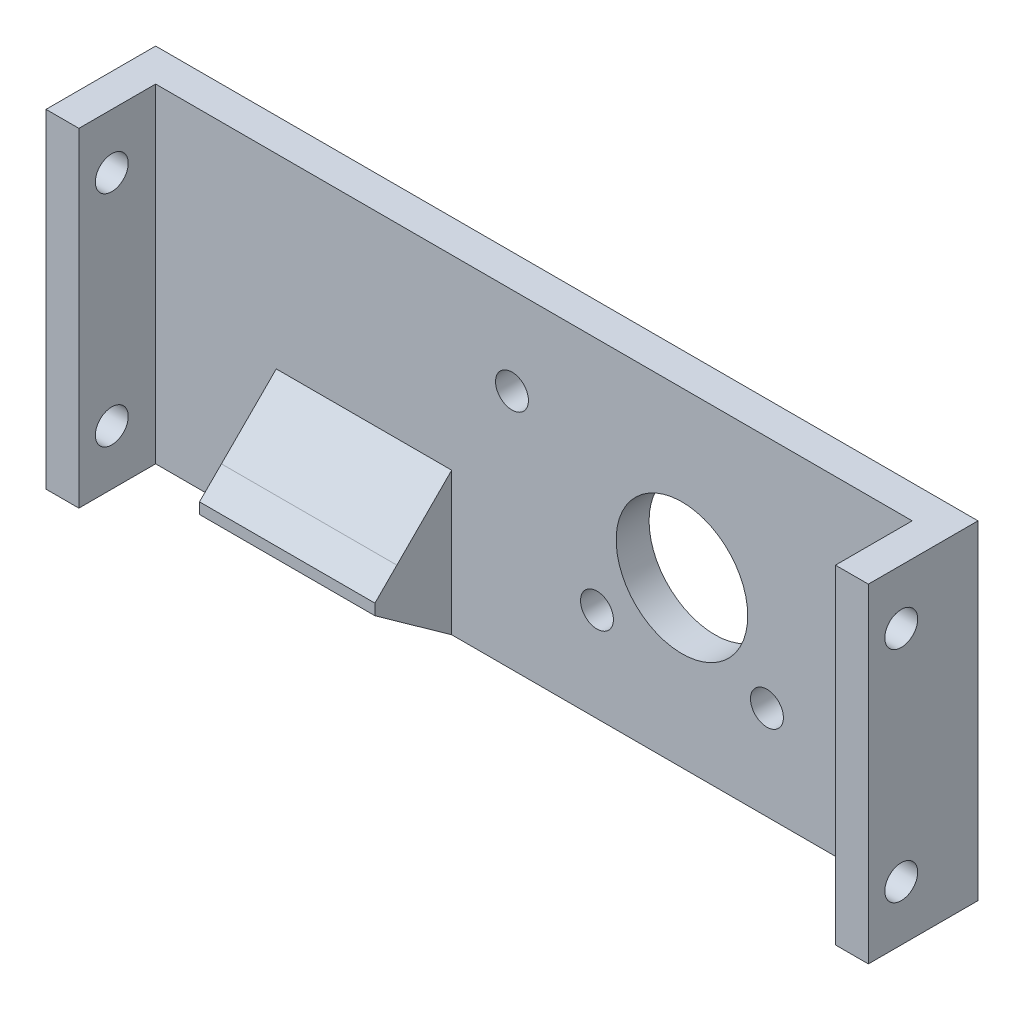
from build123d import *

# Parameters (mm, degrees)
SKETCH1_W               = 75
SKETCH1_H               = 30
BOSS_EXTRUDE1_DEPTH     = 3
SKETCH2_W               = 3
SKETCH2_H               = 30
BOSS_EXTRUDE2_DEPTH     = 10
SKETCH4_R               = 1.5
CUT_EXTRUDE1_DEPTH      = 3
MIRROR1_COPY_1_SKETCH_R = 1.5
MIRROR1_COPY_1_DEPTH    = 3
SKETCH5_R               = 6
SKETCH5_R_2             = 1.5
CUT_EXTRUDE2_DEPTH      = 10
SKETCH6_W               = 16
SKETCH6_H               = 7
BOSS_EXTRUDE3_DEPTH     = 8
CHAMFER1_SIZE           = 7
CHAMFER1_SIZE2          = 5
SKETCH7_R               = 1.5
CUT_EXTRUDE3_DEPTH      = 5
CHAMFER2_SIZE           = 5
CHAMFER3_SIZE           = 2
CUT_EXTRUDE4_START      = -5
CUT_EXTRUDE4_DEPTH      = 42.544442581


with BuildPart() as part:
    # Sketch1 → Boss-Extrude1 (new body)
    with BuildSketch(Plane.XY):
        Rectangle(SKETCH1_W, SKETCH1_H)
    extrude(amount=BOSS_EXTRUDE1_DEPTH)

    # Sketch2 → Boss-Extrude2 (add)
    with BuildSketch(Plane(origin=(0, 0, 0), x_dir=(-1, 0, 0), z_dir=(0, 0, -1))):
        with Locations((-36, 0)):
            Rectangle(SKETCH2_W, SKETCH2_H)
    boss_extrude2 = extrude(amount=-BOSS_EXTRUDE2_DEPTH)

    # Sketch4 → Cut-Extrude1 (cut)
    with BuildSketch(Plane.ZY.offset(-34.5)):
        with Locations((7, 10)):
            Circle(SKETCH4_R)
    cut_extrude1 = extrude(amount=-CUT_EXTRUDE1_DEPTH, mode=Mode.SUBTRACT)

    # Mirror2: Cut-Extrude1 across plane
    add(cut_extrude1.mirror(Plane.ZX), mode=Mode.SUBTRACT)

    # Mirror1: Boss-Extrude2, Cut-Extrude1 across plane
    add(boss_extrude2.mirror(Plane(origin=(0, 0, 0), x_dir=(0, 0, 1), z_dir=(1, 0, 0))))
    add(cut_extrude1.mirror(Plane(origin=(0, 0, 0), x_dir=(0, 0, 1), z_dir=(1, 0, 0))), mode=Mode.SUBTRACT)

    # Mirror1 copy 1 sketch → Mirror1 copy 1 (cut)
    with BuildSketch(Plane(origin=(-34.5, 0, 0), x_dir=(0, 0, 1), z_dir=(1, 0, 0))):
        with Locations((7, 10)):
            Circle(MIRROR1_COPY_1_SKETCH_R)
    extrude(amount=-MIRROR1_COPY_1_DEPTH, mode=Mode.SUBTRACT)

    # Sketch5 → Cut-Extrude2 (cut)
    with BuildSketch(Plane.XY.offset(3)):
        with Locations((13.5, 0)):
            Circle(SKETCH5_R)
        with Locations((29, 7)):
            Circle(SKETCH5_R_2)
        with Locations((21.25, -6.423393759)):
            Circle(SKETCH5_R_2)
        with Locations((5.75, -6.423393759)):
            Circle(SKETCH5_R_2)
        with Locations((-2, 7)):
            Circle(SKETCH5_R_2)
    extrude(amount=-CUT_EXTRUDE2_DEPTH, mode=Mode.SUBTRACT)

    # Sketch6 → Boss-Extrude3 (add)
    with BuildSketch(Plane.XZ.offset(15)):
        with Locations((-15.5, 6.5)):
            Rectangle(SKETCH6_W, SKETCH6_H)
    extrude(amount=-BOSS_EXTRUDE3_DEPTH)

    # Chamfer1
    chamfer1_edges = [part.edges().sort_by_distance(p)[0] for p in [
        (-15.5, -15, 10),
    ]]
    chamfer1_side = [part.faces().sort_by_distance(p)[0] for p in [
        (0, -15, 0.756637298),
    ]]
    chamfer(chamfer1_edges, length=CHAMFER1_SIZE, length2=CHAMFER1_SIZE2, reference=chamfer1_side[0])

    # Sketch7 → Cut-Extrude3 (cut)
    with BuildSketch(Plane(origin=(0, -11.351351351, 8.108108108), x_dir=(1, 0, 0), z_dir=(0, -0.8137334712067348, 0.5812381937190968))):
        with Locations(Location((-19.5, -2.277372492, 0), (0, 0, 270))):
            Circle(SKETCH7_R)
        with Locations(Location((-11.5, -2.277372492, 0), (0, 0, 270))):
            Circle(SKETCH7_R)
    extrude(amount=-CUT_EXTRUDE3_DEPTH, mode=Mode.SUBTRACT)

    # Chamfer2
    chamfer2_edges = [part.edges().sort_by_distance(p)[0] for p in [
        (-15.5, -7, 3),
    ]]
    chamfer(chamfer2_edges, length=CHAMFER2_SIZE)

    # Chamfer3
    chamfer3_edges = [part.edges().sort_by_distance(p)[0] for p in [
        (-15.5, -7, 10),
    ]]
    chamfer(chamfer3_edges, length=CHAMFER3_SIZE - 0.0001)  # a hair under: the kernel refuses the full size

    # Sketch8 → Cut-Extrude4 (cut, through all)
    with BuildSketch(Plane(origin=(0, -11.351351351, 8.108108108), x_dir=(1, 0, 0), z_dir=(0, -0.8137334712067347, 0.5812381937190967)).offset(CUT_EXTRUDE4_START)):
        Polygon((-16.324573519, -2.277372492), (-17.91228676, 0.472627508), (-21.08771324, 0.472627508), (-22.675426481, -2.277372492), (-21.08771324, -5.027372492), (-17.91228676, -5.027372492), align=None)
        Polygon((-8.324573519, -2.277372492), (-9.91228676, 0.472627508), (-13.08771324, 0.472627508), (-14.675426481, -2.277372492), (-13.08771324, -5.027372492), (-9.91228676, -5.027372492), align=None)
    extrude(amount=-CUT_EXTRUDE4_DEPTH, mode=Mode.SUBTRACT)


solid = part.part
